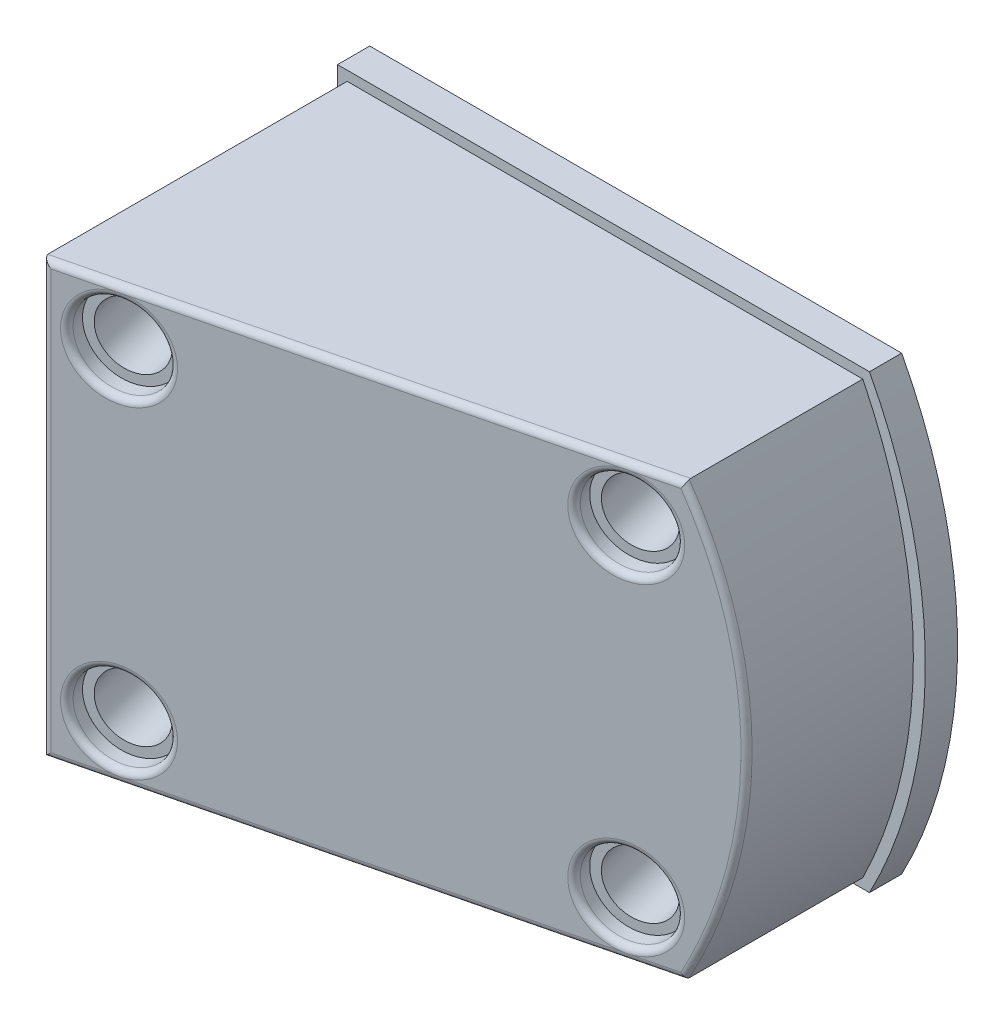
from build123d import *

# Parameters (mm, degrees)
BOSS_EXTRUDE1_DEPTH = 5
BOSS_EXTRUDE2_REACH = 84.916
SKETCH3_R           = 5
CUT_EXTRUDE1_DEPTH  = 25
SKETCH4_R           = 6.5
CUT_EXTRUDE2_DEPTH  = 3
FILLET1_R           = 1


with BuildPart() as part:
    # Sketch1 → Boss-Extrude1 (new body)
    with BuildSketch(Plane.XY):
        with BuildLine():
            Line((-16.204881352, 35), (-16.204881352, -35))
            Line((-16.204881352, -35), (66.332495807, -35))
            ThreePointArc((66.332495807, -35), (75, 0), (66.332495807, 35))
            Line((66.332495807, 35), (-16.204881352, 35))
        make_face()
    extrude(amount=BOSS_EXTRUDE1_DEPTH)

    # Boss-Extrude2: up to this plane
    boss_extrude2_end = Plane(origin=(7.525658293, -40, 47.009794297), z_dir=(-0.239863978039186, 0, -0.9708065059728519))
    # Sketch2 → Boss-Extrude2 (add, up to the surface)
    with BuildSketch(Plane.XY.offset(5), mode=Mode.PRIVATE) as boss_extrude2_sk1:
        with BuildLine():
            Line((65.295118648, 33.5), (-14.704881352, 33.5))
            Line((-14.704881352, 33.5), (-14.704881352, -33.5))
            Line((-14.704881352, -33.5), (65.295118648, -33.5))
            ThreePointArc((65.295118648, -33.5), (73.141235595, 0), (65.295118648, 33.5))
        make_face()
    boss_extrude2_tool1 = split(extrude(boss_extrude2_sk1.sketch, amount=BOSS_EXTRUDE2_REACH, mode=Mode.PRIVATE), bisect_by=boss_extrude2_end, keep=Keep.BOTH, mode=Mode.PRIVATE)
    add(boss_extrude2_tool1.solids().sort_by_distance((27.970522, 0, 5))[0])

    # Sketch3 → Cut-Extrude1 (cut)
    with BuildSketch(Plane(origin=(11.379758408, 0, 46.057534728), x_dir=(0.970806505972852, 0, -0.23986397803918558), z_dir=(0.2398639780391856, 0, 0.9708065059728521))):
        with Locations((-16.869040946, 25)):
            Circle(SKETCH3_R)
        with Locations((-16.869040946, -25)):
            Circle(SKETCH3_R)
        with Locations((48.130959054, -25)):
            Circle(SKETCH3_R)
        with Locations((48.130959054, 25)):
            Circle(SKETCH3_R)
    extrude(amount=-CUT_EXTRUDE1_DEPTH, mode=Mode.SUBTRACT)

    # Sketch4 → Cut-Extrude2 (cut)
    with BuildSketch(Plane(origin=(11.379758408, 0, 46.057534728), x_dir=(0.970806505972852, 0, -0.23986397803918558), z_dir=(0.2398639780391856, 0, 0.9708065059728521))):
        with Locations((-16.869040946, 25)):
            Circle(SKETCH4_R)
        with Locations((-16.869040946, -25)):
            Circle(SKETCH4_R)
        with Locations((48.130959054, -25)):
            Circle(SKETCH4_R)
        with Locations((48.130959054, 25)):
            Circle(SKETCH4_R)
    extrude(amount=-CUT_EXTRUDE2_DEPTH, mode=Mode.SUBTRACT)

    # Fillet1
    fillet1_edges = [part.edges().sort_by_distance(p)[0] for p in [
        (25.295118648, -33.5, 42.619368994),
        (-14.704881352, 0, 52.502449775),
        (25.295118648, 33.5, 42.619368994),
        (73.141235595, 0, 30.797693023),
        (-11.307058581, 25, 51.662925852),
        (51.795364307, 25, 36.07176728),
        (51.795364307, -25, 36.07176728),
        (-11.307058581, -25, 51.662925852),
    ]]
    fillet(fillet1_edges, radius=FILLET1_R - 0.0001)  # a hair under: the kernel refuses the full size


solid = part.part
